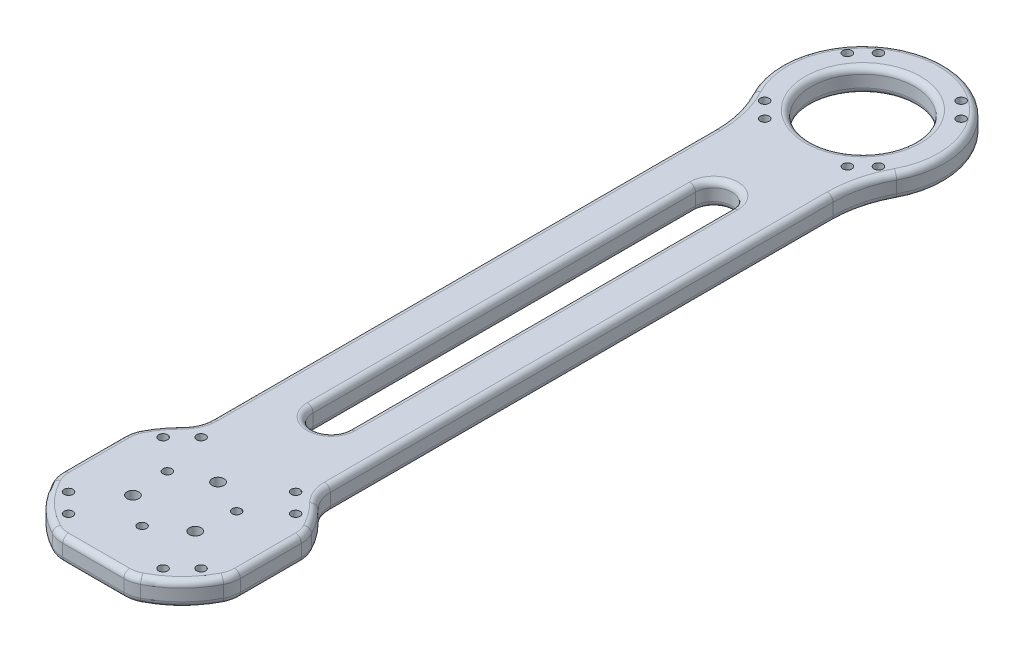
from build123d import *

# Parameters (mm, degrees)
SKETCH_1_R               = 1.5
SKETCH_1_R_2             = 2
SKETCH_1_R_3             = 17.5
EXTRUDE_1_DEPTH          = 8
FILLET_1_R               = 2
CUT_EXTRUDE_1_DEPTH      = 18
CUT_EXTRUDE_1_DEPTH_BACK = 21.5
FILLET_2_R               = 2


with BuildPart() as part:
    # 草图1 → 凸台-拉伸1 (new body)
    with BuildSketch(Plane(origin=(0, 0, 0), x_dir=(1, 0, 0), z_dir=(0, 1, 0))):
        with BuildLine():
            Line((-20, -84.896013553), (-20, 84.896013553))
            ThreePointArc((-20, 84.896013553), (-21.087557405, 93.760066157), (-24.285714286, 102.098291523))
            ThreePointArc((-24.285714286, 102.098291523), (0, 142.5), (24.285714286, 102.098291523))
            ThreePointArc((24.285714286, 102.098291523), (21.087557405, 93.760066157), (20, 84.896013553))
            Line((20, 84.896013553), (20, -84.896013553))
            ThreePointArc((20, -84.896013553), (20.764518548, -88.730838497), (22.941176471, -91.979304482))
            ThreePointArc((22.941176471, -91.979304482), (26.232042756, -95.813287596), (28.888888889, -100.111007463))
            ThreePointArc((28.888888889, -100.111007463), (29.718253158, -102.335213332), (30, -104.692235936))
            Line((30, -104.692235936), (30, -125.307764064))
            ThreePointArc((30, -125.307764064), (29.718253158, -127.664786668), (28.888888889, -129.888992537))
            ThreePointArc((28.888888889, -129.888992537), (22.980970389, -137.980970389), (14.888992537, -143.888888889))
            ThreePointArc((14.888992537, -143.888888889), (12.664786668, -144.718253158), (10.307764064, -145))
            Line((10.307764064, -145), (-10.307764064, -145))
            ThreePointArc((-10.307764064, -145), (-12.664786668, -144.718253158), (-14.888992537, -143.888888889))
            ThreePointArc((-14.888992537, -143.888888889), (-22.980970389, -137.980970389), (-28.888888889, -129.888992537))
            ThreePointArc((-28.888888889, -129.888992537), (-29.718253158, -127.664786668), (-30, -125.307764064))
            Line((-30, -125.307764064), (-30, -104.692235936))
            ThreePointArc((-30, -104.692235936), (-29.718253158, -102.335213332), (-28.888888889, -100.111007463))
            ThreePointArc((-28.888888889, -100.111007463), (-26.232042756, -95.813287596), (-22.941176471, -91.979304482))
            ThreePointArc((-22.941176471, -91.979304482), (-20.764518548, -88.730838497), (-20, -84.896013553))
        make_face()
        with Locations((-15.969331282, -92.611823245)):
            Circle(SKETCH_1_R, mode=Mode.SUBTRACT)
        with Locations((15.969331282, -92.611823245)):
            Circle(SKETCH_1_R, mode=Mode.SUBTRACT)
        with Locations((-22.388176755, -130.969331282)):
            Circle(SKETCH_1_R, mode=Mode.SUBTRACT)
        with Locations((-22.388176755, -99.030668718)):
            Circle(SKETCH_1_R, mode=Mode.SUBTRACT)
        with Locations((-15.969331282, -137.388176755)):
            Circle(SKETCH_1_R, mode=Mode.SUBTRACT)
        with Locations((15.969331282, -137.388176755)):
            Circle(SKETCH_1_R, mode=Mode.SUBTRACT)
        with Locations((22.388176755, -130.969331282)):
            Circle(SKETCH_1_R, mode=Mode.SUBTRACT)
        with Locations((22.388176755, -99.030668718)):
            Circle(SKETCH_1_R, mode=Mode.SUBTRACT)
        with Locations((0, -102.85)):
            Circle(SKETCH_1_R_2, mode=Mode.SUBTRACT)
        with Locations((10.522208656, -121.075)):
            Circle(SKETCH_1_R_2, mode=Mode.SUBTRACT)
        with Locations((-10.522208656, -121.075)):
            Circle(SKETCH_1_R_2, mode=Mode.SUBTRACT)
        with Locations((0, -128.5)):
            Circle(SKETCH_1_R, mode=Mode.SUBTRACT)
        with Locations((-11.691342951, -108.25)):
            Circle(SKETCH_1_R, mode=Mode.SUBTRACT)
        with Locations((11.691342951, -108.25)):
            Circle(SKETCH_1_R, mode=Mode.SUBTRACT)
        with Locations((0, 115)):
            Circle(SKETCH_1_R_3, mode=Mode.SUBTRACT)
        with Locations((-19.214153616, 128.959899742)):
            Circle(SKETCH_1_R, mode=Mode.SUBTRACT)
        with Locations((-13.959899742, 134.214153616)):
            Circle(SKETCH_1_R, mode=Mode.SUBTRACT)
        with Locations((13.959899742, 134.214153616)):
            Circle(SKETCH_1_R, mode=Mode.SUBTRACT)
        with Locations((19.214153616, 128.959899742)):
            Circle(SKETCH_1_R, mode=Mode.SUBTRACT)
        with Locations((-19.214153616, 101.040100258)):
            Circle(SKETCH_1_R, mode=Mode.SUBTRACT)
        with Locations((-13.959899742, 95.785846384)):
            Circle(SKETCH_1_R, mode=Mode.SUBTRACT)
        with Locations((13.959899742, 95.785846384)):
            Circle(SKETCH_1_R, mode=Mode.SUBTRACT)
        with Locations((19.214153616, 101.040100258)):
            Circle(SKETCH_1_R, mode=Mode.SUBTRACT)
    extrude(amount=EXTRUDE_1_DEPTH)

    # 圆角1
    fillet_1_edges = [part.edges().sort_by_distance(p)[0] for p in [
        (-21.087557405, 8, -93.760066157),
        (0, 8, -142.5),
        (20, 8, 0),
        (20.764518548, 8, 88.730838497),
        (26.232042756, 8, 95.813287596),
        (29.718253158, 8, 102.335213332),
        (30, 8, 115),
        (29.718253158, 8, 127.664786668),
        (22.980970389, 8, 137.980970389),
        (12.664786668, 8, 144.718253158),
        (0, 8, 145),
        (-12.664786668, 8, 144.718253158),
        (-22.980970389, 8, 137.980970389),
        (-29.718253158, 8, 127.664786668),
        (-30, 8, 115),
        (-29.718253158, 8, 102.335213332),
        (-26.232042756, 8, 95.813287596),
        (-20.764518548, 8, 88.730838497),
        (-20, 8, 0),
        (-17.5, 8, -115),
        (-17.5, 0, -115),
        (21.087557405, 8, -93.760066157),
    ]]
    fillet(fillet_1_edges, radius=FILLET_1_R)

    # 草图2 → 切除-拉伸1 (cut, two sides: drawn at the far end of the back side and taken through both)
    with BuildSketch(Plane.XZ.offset(-CUT_EXTRUDE_1_DEPTH_BACK)):
        with BuildLine():
            Line((6.151913725, 64.600455658), (6.151913725, -64.600455658))
            ThreePointArc((6.151913725, -64.600455658), (0, -70.752369383), (-6.151913725, -64.600455658))
            Line((-6.151913725, -64.600455658), (-6.151913725, 64.600455658))
            ThreePointArc((-6.151913725, 64.600455658), (0, 70.752369383), (6.151913725, 64.600455658))
        make_face()
    extrude(amount=CUT_EXTRUDE_1_DEPTH + CUT_EXTRUDE_1_DEPTH_BACK, mode=Mode.SUBTRACT)

    # 圆角2
    fillet_2_edges = [part.edges().sort_by_distance(p)[0] for p in [
        (0, 8, -70.752369383),
        (-6.151913725, 8, 0),
        (0, 8, 70.752369383),
        (0, 0, -70.752369383),
        (-6.151913725, 0, 0),
        (0, 0, 70.752369383),
        (-21.087557405, 0, -93.760066157),
        (0, 0, -142.5),
        (20, 0, 0),
        (20.764518548, 0, 88.730838497),
        (26.232042756, 0, 95.813287596),
        (29.718253158, 0, 102.335213332),
        (30, 0, 115),
        (29.718253158, 0, 127.664786668),
        (22.980970389, 0, 137.980970389),
        (12.664786668, 0, 144.718253158),
        (0, 0, 145),
        (-12.664786668, 0, 144.718253158),
        (-22.980970389, 0, 137.980970389),
        (-29.718253158, 0, 127.664786668),
        (-30, 0, 115),
        (-29.718253158, 0, 102.335213332),
        (-26.232042756, 0, 95.813287596),
        (-20.764518548, 0, 88.730838497),
        (6.151913725, 8, 0),
        (6.151913725, 0, 0),
        (-20, 0, 0),
        (21.087557405, 0, -93.760066157),
    ]]
    fillet(fillet_2_edges, radius=FILLET_2_R)


solid = part.part
